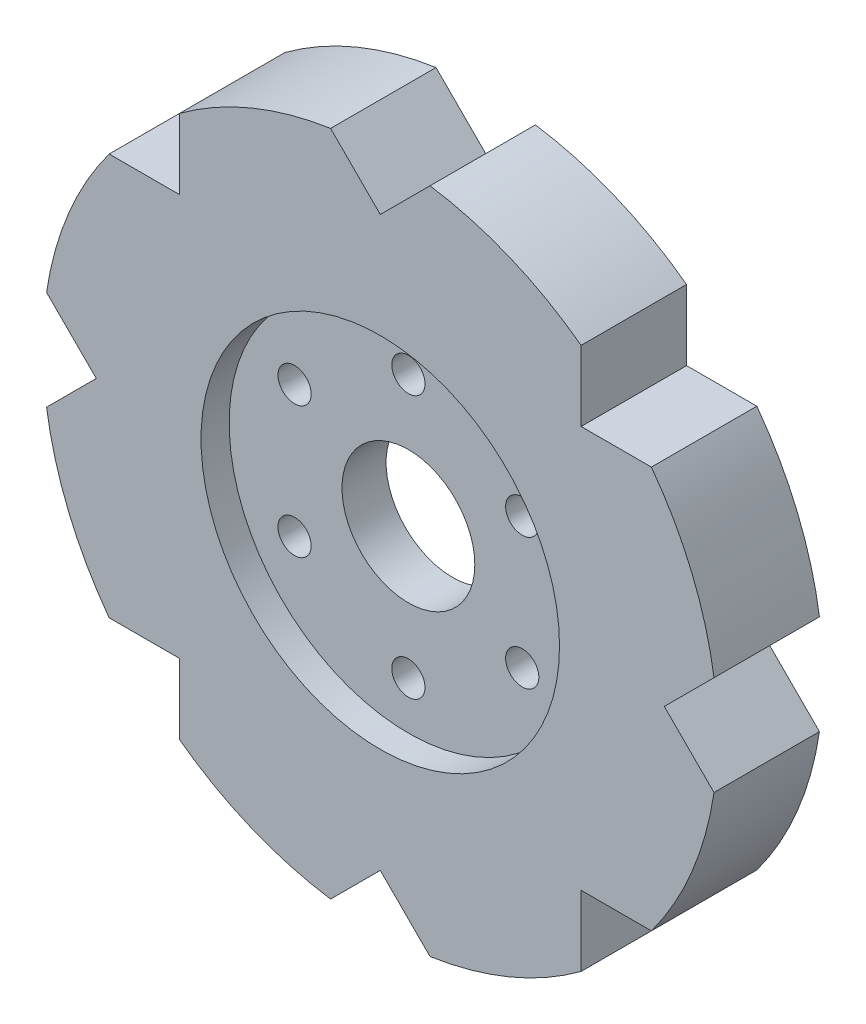
from build123d import *

# Parameters (mm, degrees)
BOSS_EXTRUDE1_DEPTH   = 19.05
SKETCH2_R             = 12
CUT_EXTRUDE1_DEPTH    = 88.371938859
SKETCH3_R             = 32.385
CUT_EXTRUDE2_DEPTH    = 5.08
SKETCH4_R             = 28.4
CUT_EXTRUDE3_DEPTH    = 6
F_6_0MM_DOWEL_HOLE1_D = 6


with BuildPart() as part:
    # Sketch1 → Boss-Extrude1 (new body)
    with BuildSketch(Plane.XY):
        with BuildLine():
            Line((-8.980256121, 60.29491355), (0, 51.314657429))
            Line((0, 51.314657429), (8.980256121, 60.29491355))
            ThreePointArc((8.980256121, 60.29491355), (23.328382037, 56.319696302), (36.284942242, 48.984942242))
            Line((36.284942242, 48.984942242), (36.284942242, 36.284942242))
            Line((36.284942242, 36.284942242), (48.984942242, 36.284942242))
            ThreePointArc((48.984942242, 36.284942242), (56.319696302, 23.328382037), (60.29491355, 8.980256121))
            Line((60.29491355, 8.980256121), (51.314657429, 0))
            Line((51.314657429, 0), (60.29491355, -8.980256121))
            ThreePointArc((60.29491355, -8.980256121), (56.319696302, -23.328382037), (48.984942242, -36.284942242))
            Line((48.984942242, -36.284942242), (36.284942242, -36.284942242))
            Line((36.284942242, -36.284942242), (36.284942242, -48.984942242))
            ThreePointArc((36.284942242, -48.984942242), (23.328382037, -56.319696302), (8.980256121, -60.29491355))
            Line((8.980256121, -60.29491355), (0, -51.314657429))
            Line((0, -51.314657429), (-8.980256121, -60.29491355))
            ThreePointArc((-8.980256121, -60.29491355), (-23.328382037, -56.319696302), (-36.284942242, -48.984942242))
            Line((-36.284942242, -48.984942242), (-36.284942242, -36.284942242))
            Line((-36.284942242, -36.284942242), (-48.984942242, -36.284942242))
            ThreePointArc((-48.984942242, -36.284942242), (-56.319696302, -23.328382037), (-60.29491355, -8.980256121))
            Line((-60.29491355, -8.980256121), (-51.314657429, 0))
            Line((-51.314657429, 0), (-60.29491355, 8.980256121))
            ThreePointArc((-60.29491355, 8.980256121), (-56.319696302, 23.328382037), (-48.984942242, 36.284942242))
            Line((-48.984942242, 36.284942242), (-36.284942242, 36.284942242))
            Line((-36.284942242, 36.284942242), (-36.284942242, 48.984942242))
            ThreePointArc((-36.284942242, 48.984942242), (-23.328382037, 56.319696302), (-8.980256121, 60.29491355))
        make_face()
    extrude(amount=BOSS_EXTRUDE1_DEPTH)

    # Sketch2 → Cut-Extrude1 (cut, through all)
    with BuildSketch(Plane.XY.offset(19.05)):
        Circle(SKETCH2_R)
    extrude(amount=-CUT_EXTRUDE1_DEPTH, mode=Mode.SUBTRACT)

    # Sketch3 → Cut-Extrude2 (cut)
    with BuildSketch(Plane.XY.offset(19.05)):
        Circle(SKETCH3_R)
    extrude(amount=-CUT_EXTRUDE2_DEPTH, mode=Mode.SUBTRACT)

    # Sketch4 → Cut-Extrude3 (cut)
    with BuildSketch(Plane(origin=(0, 0, 0), x_dir=(-1, 0, 0), z_dir=(0, 0, -1))):
        Circle(SKETCH4_R)
    extrude(amount=-CUT_EXTRUDE3_DEPTH, mode=Mode.SUBTRACT)

    # Ø6.0mm Dowel Hole1 (through all)
    with Locations(Plane(origin=(0, 0, 6), x_dir=(-1, 0, 0), z_dir=(0, 0, -1))):
        with Locations((0, 23.75), (20.56810334, 11.875), (20.56810334, -11.875), (0, -23.75), (-20.56810334, 11.875), (-20.56810334, -11.875)):
            Hole(F_6_0MM_DOWEL_HOLE1_D / 2)


solid = part.part
